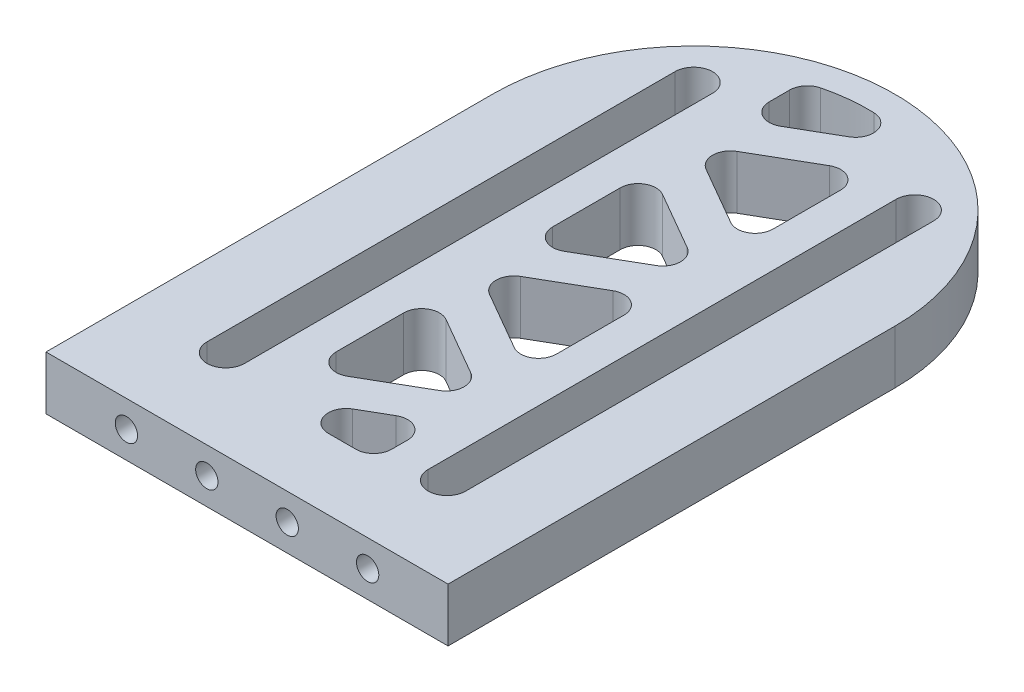
from build123d import *

# Parameters (mm, degrees)
EXTRUDE_1_DEPTH     = 6
CUT_EXTRUDE_1_DEPTH = 56.156595254
CUT_EXTRUDE_2_REACH = 57.157
FILLET_18_R         = 2
M3X0_51_D           = 2.5
M3X0_51_DEPTH       = 8.5
M3X0_51_TIP         = 0.751075774


with BuildPart() as part:
    # Эскиз1 → Бобышка-Вытянуть1 (new body)
    with BuildSketch(Plane(origin=(0, 0, 0), x_dir=(1, 0, 0), z_dir=(0, 1, 0))):
        with BuildLine():
            Line((-22.5, 0), (-22.5, -50))
            Line((-22.5, -50), (22.5, -50))
            Line((22.5, -50), (22.5, 0))
            ThreePointArc((22.5, 0), (0, 22.5), (-22.5, 0))
        make_face()
    extrude(amount=EXTRUDE_1_DEPTH)

    # Эскиз2 → Вырез-Вытянуть1 (cut, through all)
    with BuildSketch(Plane(origin=(0, 6, 0), x_dir=(1, 0, 0), z_dir=(0, 1, 0))):
        with BuildLine():
            Line((-10.274368671, 12.374368671), (-10.274368671, -40))
            ThreePointArc((-10.274368671, -40), (-12.374368671, -42.1), (-14.474368671, -40))
            Line((-14.474368671, -40), (-14.474368671, 12.374368671))
            ThreePointArc((-14.474368671, 12.374368671), (-12.374368671, 14.474368671), (-10.274368671, 12.374368671))
        make_face()
        with BuildLine():
            Line((10.274368671, 12.374368671), (10.274368671, -40))
            ThreePointArc((10.274368671, -40), (12.374368671, -42.1), (14.474368671, -40))
            Line((14.474368671, -40), (14.474368671, 12.374368671))
            ThreePointArc((14.474368671, 12.374368671), (12.374368671, 14.474368671), (10.274368671, 12.374368671))
        make_face()
    extrude(amount=-CUT_EXTRUDE_1_DEPTH, mode=Mode.SUBTRACT)

    # Эскиз11 → Вырез-Вытянуть2 (cut, up to next)
    with BuildSketch(Plane(origin=(0, 6, 0), x_dir=(1, 0, 0), z_dir=(0, 1, 0)), mode=Mode.PRIVATE) as cut_extrude_2_sk1:
        with BuildLine():
            Line((6.274368671, 18.5), (-6.274368671, 11.254983118))
            Line((-6.274368671, 11.254983118), (-6.274368671, 18.5))
            ThreePointArc((-6.274368671, 18.5), (0, 19.535037809), (6.274368671, 18.5))
        make_face()
    cut_extrude_2_tool1 = extrude(cut_extrude_2_sk1.sketch, amount=-CUT_EXTRUDE_2_REACH, mode=Mode.PRIVATE) & part.part
    # Эскиз11 → Вырез-Вытянуть2 (cut, up to next)
    with BuildSketch(Plane(origin=(0, 6, 0), x_dir=(1, 0, 0), z_dir=(0, 1, 0)), mode=Mode.PRIVATE) as cut_extrude_2_sk2:
        Polygon((6.274368671, 13.627163728), (-6.274368671, 6.382146846), (6.274368671, -0.862870036), align=None)
    cut_extrude_2_tool2 = extrude(cut_extrude_2_sk2.sketch, amount=-CUT_EXTRUDE_2_REACH, mode=Mode.PRIVATE) & part.part
    # Эскиз11 → Вырез-Вытянуть2 (cut, up to next)
    with BuildSketch(Plane(origin=(0, 6, 0), x_dir=(1, 0, 0), z_dir=(0, 1, 0)), mode=Mode.PRIVATE) as cut_extrude_2_sk3:
        Polygon((-6.274368671, 1.509310574), (6.274368671, -5.735706308), (-6.274368671, -12.98072319), align=None)
    cut_extrude_2_tool3 = extrude(cut_extrude_2_sk3.sketch, amount=-CUT_EXTRUDE_2_REACH, mode=Mode.PRIVATE) & part.part
    # Эскиз11 → Вырез-Вытянуть2 (cut, up to next)
    with BuildSketch(Plane(origin=(0, 6, 0), x_dir=(1, 0, 0), z_dir=(0, 1, 0)), mode=Mode.PRIVATE) as cut_extrude_2_sk4:
        Polygon((-6.274368671, -17.853559462), (6.274368671, -10.60854258), (6.274368671, -25.098576344), align=None)
    cut_extrude_2_tool4 = extrude(cut_extrude_2_sk4.sketch, amount=-CUT_EXTRUDE_2_REACH, mode=Mode.PRIVATE) & part.part
    # Эскиз11 → Вырез-Вытянуть2 (cut, up to next)
    with BuildSketch(Plane(origin=(0, 6, 0), x_dir=(1, 0, 0), z_dir=(0, 1, 0)), mode=Mode.PRIVATE) as cut_extrude_2_sk5:
        Polygon((-6.274368671, -22.726395734), (6.274368671, -29.971412616), (-6.274368671, -37.216429498), align=None)
    cut_extrude_2_tool5 = extrude(cut_extrude_2_sk5.sketch, amount=-CUT_EXTRUDE_2_REACH, mode=Mode.PRIVATE) & part.part
    # Эскиз11 → Вырез-Вытянуть2 (cut, up to next)
    with BuildSketch(Plane(origin=(0, 6, 0), x_dir=(1, 0, 0), z_dir=(0, 1, 0)), mode=Mode.PRIVATE) as cut_extrude_2_sk6:
        Polygon((-6.274368671, -42.08926577), (6.274368671, -34.844248888), (6.274368671, -42.08926577), align=None)
    cut_extrude_2_tool6 = extrude(cut_extrude_2_sk6.sketch, amount=-CUT_EXTRUDE_2_REACH, mode=Mode.PRIVATE) & part.part
    add(cut_extrude_2_tool1.solids().sort_by_distance((-1.755291, 6, -16.539864))[0], mode=Mode.SUBTRACT)
    add(cut_extrude_2_tool2.solids().sort_by_distance((2.091456, 6, -6.382147))[0], mode=Mode.SUBTRACT)
    add(cut_extrude_2_tool3.solids().sort_by_distance((-2.091456, 6, 5.735706))[0], mode=Mode.SUBTRACT)
    add(cut_extrude_2_tool4.solids().sort_by_distance((2.091456, 6, 17.853559))[0], mode=Mode.SUBTRACT)
    add(cut_extrude_2_tool5.solids().sort_by_distance((-2.091456, 6, 29.971413))[0], mode=Mode.SUBTRACT)
    add(cut_extrude_2_tool6.solids().sort_by_distance((2.091456, 6, 39.67426))[0], mode=Mode.SUBTRACT)

    # Скругление18
    fillet_18_edges = [part.edges().sort_by_distance(p)[0] for p in [
        (6.274368671, 3, 25.098576344),
        (6.274368671, 3, 0.862870036),
        (-6.274368671, 3, -18.5),
        (-6.274368671, 3, -1.509310574),
        (-6.274368671, 3, 22.726395734),
        (-6.274368671, 3, -6.382146846),
        (-6.274368671, 3, 17.853559462),
        (-6.274368671, 3, -11.254983118),
        (-6.274368671, 3, 12.98072319),
        (-6.274368671, 3, 37.216429498),
        (6.274368671, 3, -18.5),
        (6.274368671, 3, 5.735706308),
        (6.274368671, 3, 29.971412616),
        (6.274368671, 3, -13.627163728),
        (6.274368671, 3, 10.60854258),
        (6.274368671, 3, 34.844248888),
        (6.274368671, 3, 42.08926577),
        (-6.274368671, 3, 42.08926577),
    ]]
    fillet(fillet_18_edges, radius=FILLET_18_R)

    # Отверстие обработанное метчиком M3x0.51
    with Locations(Plane.XY.offset(50)):
        with Locations((-13.5, 3), (-4.5, 3), (4.5, 3), (13.5, 3)):
            Hole(M3X0_51_D / 2, depth=M3X0_51_DEPTH)
            with Locations((0, 0, -(M3X0_51_DEPTH + M3X0_51_TIP / 2))):  # 118° drill point
                Cone(0, M3X0_51_D / 2, M3X0_51_TIP, mode=Mode.SUBTRACT)


solid = part.part
